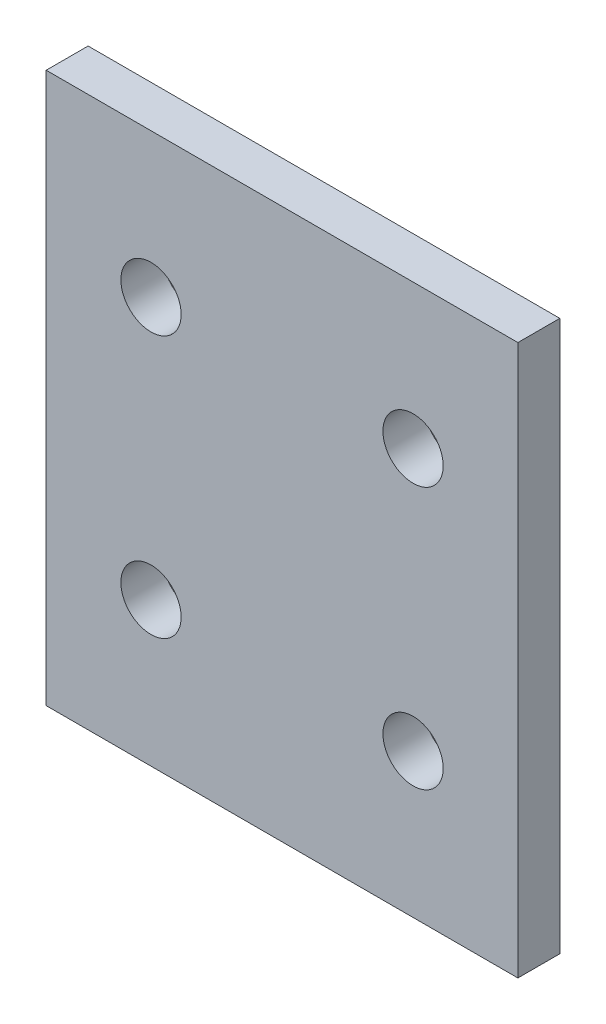
from build123d import *

# Parameters (mm, degrees)
SKETCH_1_W             = 180
SKETCH_1_H             = 210
SKETCH_1_R             = 11.5
SM_BASE_FLANGE_1_DEPTH = 16


# Sheet-metal steps are written as plain solids
with BuildPart() as part:
    # Sketch 1 → Базовая кромка1 (new body)
    with BuildSketch(Plane.XY):
        with Locations((90, -105)):
            Rectangle(SKETCH_1_W, SKETCH_1_H)
        with Locations((40, -55)):
            Circle(SKETCH_1_R, mode=Mode.SUBTRACT)
        with Locations(Location((140, -55, 0), (0, 0, 180))):
            Circle(SKETCH_1_R, mode=Mode.SUBTRACT)
        with Locations((140, -155)):
            Circle(SKETCH_1_R, mode=Mode.SUBTRACT)
        with Locations(Location((40, -155, 0), (0, 0, 180))):
            Circle(SKETCH_1_R, mode=Mode.SUBTRACT)
    extrude(amount=-SM_BASE_FLANGE_1_DEPTH)


solid = part.part
